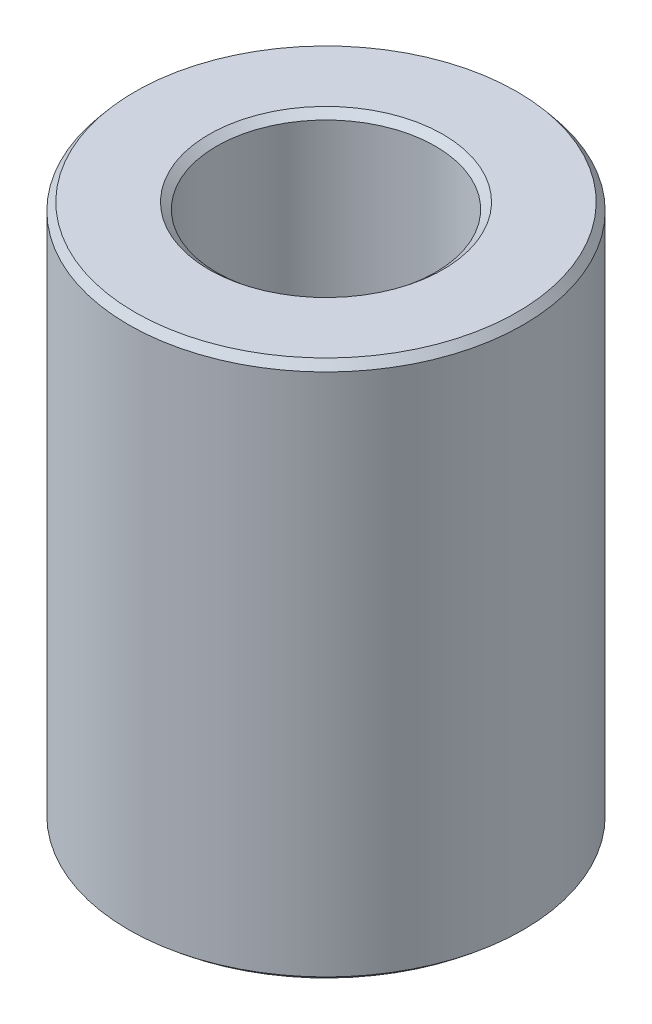
from build123d import *
from OCP.BRepFilletAPI import BRepFilletAPI_MakeChamfer

# Parameters (mm, degrees)
SKETCH1_R           = 40
BOSS_EXTRUDE1_DEPTH = 108.992177685
SKETCH2_R           = 22.166355729
CUT_EXTRUDE1_DEPTH  = 123.797780096
CHAMFER1_SIZE       = 1.553708351
CHAMFER1_SIZE2      = 1.284440514


with BuildPart() as part:
    # Sketch1 → Boss-Extrude1 (new body)
    with BuildSketch(Plane(origin=(0, 0, 0), x_dir=(1, 0, 0), z_dir=(0, 1, 0))):
        Circle(SKETCH1_R)
    extrude(amount=BOSS_EXTRUDE1_DEPTH)

    # Sketch2 → Cut-Extrude1 (cut, through all)
    with BuildSketch(Plane(origin=(0, 0, 0), x_dir=(1, 0, 0), z_dir=(0, 1, 0))):
        Circle(SKETCH2_R)
    extrude(amount=CUT_EXTRUDE1_DEPTH, mode=Mode.SUBTRACT)

    # Chamfer1: one chamfer whose edges measure the first distance from different faces: ONE call of the kernel's chamfer builder (chamfer() names one face for all edges)
    chamfer1_edges_1 = [part.edges().sort_by_distance(p)[0] for p in [
        (-22.166355729, 108.992177685, 0),
    ]]
    chamfer1_side_1 = [part.faces().sort_by_distance(p)[0] for p in [
        (-38.86862915, 108.992177685, 0),
    ]]
    chamfer1_edges_2 = [part.edges().sort_by_distance(p)[0] for p in [
        (-22.166355729, 0, 0),
    ]]
    chamfer1_side_2 = [part.faces().sort_by_distance(p)[0] for p in [
        (-22.166355729, 54.496088843, 0),
    ]]
    chamfer1_edges_3 = [part.edges().sort_by_distance(p)[0] for p in [
        (-40, 0, 0),
    ]]
    chamfer1_side_3 = [part.faces().sort_by_distance(p)[0] for p in [
        (-38.86862915, 0, 0),
    ]]
    chamfer1_edges_4 = [part.edges().sort_by_distance(p)[0] for p in [
        (-40, 108.992177685, 0),
    ]]
    chamfer1_side_4 = [part.faces().sort_by_distance(p)[0] for p in [
        (-40, 54.496088843, 0),
    ]]
    chamfer1 = BRepFilletAPI_MakeChamfer(part.part.solid().wrapped)
    for e in chamfer1_edges_1:
        chamfer1.Add(CHAMFER1_SIZE, CHAMFER1_SIZE2, e.wrapped, chamfer1_side_1[0].wrapped)  # the first distance lies on this face
    for e in chamfer1_edges_2:
        chamfer1.Add(CHAMFER1_SIZE, CHAMFER1_SIZE2, e.wrapped, chamfer1_side_2[0].wrapped)  # the first distance lies on this face
    for e in chamfer1_edges_3:
        chamfer1.Add(CHAMFER1_SIZE, CHAMFER1_SIZE2, e.wrapped, chamfer1_side_3[0].wrapped)  # the first distance lies on this face
    for e in chamfer1_edges_4:
        chamfer1.Add(CHAMFER1_SIZE, CHAMFER1_SIZE2, e.wrapped, chamfer1_side_4[0].wrapped)  # the first distance lies on this face
    add(Compound.cast(chamfer1.Shape()), mode=Mode.REPLACE)


solid = part.part
